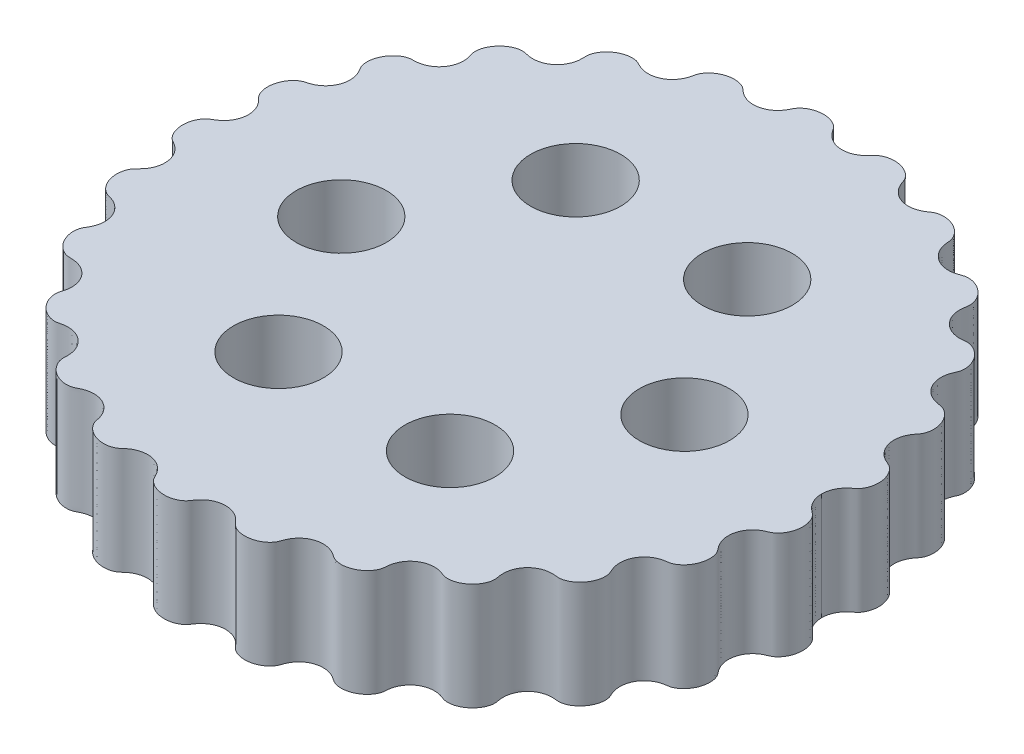
from build123d import *

# Parameters (mm, degrees)
ROTOR1_DEPTH       = 5
SKETCH5_R          = 2.1
CUT_EXTRUDE1_DEPTH = 23.326267833


with BuildPart() as part:
    # Sketch1 → Rotor1 (new body)
    with BuildSketch(Plane(origin=(0, 0, 0), x_dir=(1, 0, 0), z_dir=(0, 1, 0))):
        with BuildLine():
            add(Edge.make_bspline(
                [(14.4, -1.1e-08), (14.400000001, -0.017963894), (14.400999326, -0.054155771), (14.405496287, -0.123245553), (14.417452601, -0.205733741), (14.435300789, -0.284760877), (14.458936203, -0.363829831), (14.495530723, -0.460103307), (14.553831756, -0.577672691), (14.628963287, -0.690475205), (14.720523735, -0.795156223), (14.80987794, -0.878529689), (14.885972401, -0.9397103), (14.965266314, -0.996877195), (15.03939034, -1.060755698), (15.101813095, -1.136526895), (15.154322648, -1.21930658), (15.208602444, -1.329232804), (15.256294524, -1.468797203), (15.288097069, -1.638083711), (15.294503428, -1.881017906), (15.252298057, -2.119867925), (15.16376019, -2.344380173), (15.042398554, -2.52314005), (14.9424544, -2.628650553), (14.845312027, -2.70360375), (14.757199473, -2.750371146), (14.664408651, -2.786732336), (14.573413225, -2.826965825), (14.463621989, -2.885730191), (14.308968614, -2.990239538), (14.130503934, -3.165844743), (13.972147742, -3.43499293), (13.893985844, -3.773342005), (13.916927838, -4.080338895), (13.995171341, -4.310200428), (14.082412505, -4.468541995), (14.150259646, -4.567703683), (14.210026003, -4.642870289), (14.270573842, -4.717649144), (14.320176505, -4.800200547), (14.36541698, -4.91091898), (14.399338659, -5.049561586), (14.416852423, -5.262398452), (14.384340297, -5.500937495), (14.304056244, -5.731023401), (14.177986358, -5.941781702), (14.047854572, -6.095731645), (13.910789368, -6.208565645), (13.777136975, -6.284416215), (13.654566604, -6.325933746), (13.550560161, -6.341335346), (13.446683878, -6.355615291), (13.344146124, -6.378219331), (13.218559039, -6.416412649), (13.04911821, -6.490187823), (12.850381465, -6.623876986), (12.649361916, -6.848376683), (12.506075639, -7.152262016), (12.46299871, -7.451003009), (12.48997222, -7.692058425), (12.539204952, -7.862350555), (12.58028694, -7.968000468), (12.618270118, -8.050352823), (12.654435767, -8.133644583), (12.678284081, -8.221362494), (12.692938272, -8.335981047), (12.690655994, -8.476153316), (12.654303491, -8.685493404), (12.54522416, -8.951239009), (12.373057364, -9.183722763), (12.149188806, -9.366304637), (11.953264491, -9.463318235), (11.81158657, -9.506241349), (11.686731886, -9.522483882), (11.583489001, -9.516968781), (11.48115859, -9.503432854), (11.378198941, -9.496859112), (11.274929495, -9.498212512), (11.172138738, -9.508022541), (11.008490237, -9.538189742), (10.791018366, -9.615836409), (10.543765251, -9.778692295), (10.34743419, -10.024278367), (10.240209553, -10.268607441), (10.194326073, -10.4842437), (10.185348037, -10.638429751), (10.193137005, -10.770510335), (10.209146576, -10.879533557), (10.225593603, -10.966240354), (10.235972834, -11.05392192), (10.233096719, -11.142311638), (10.215769188, -11.253426288), (10.176716205, -11.384209809), (10.08855769, -11.57177312), (9.91455547, -11.800570796), (9.643929431, -12.015790483), (9.338394212, -12.131431673), (9.092328786, -12.151919742), (8.938831829, -12.124722538), (8.874148307, -12.104917743), (8.823297196, -12.086266856), (8.760022186, -12.062210577), (8.657742915, -12.026792744), (8.512708999, -11.991319827), (8.295428668, -11.971044841), (8.023342528, -12.005783702), (7.73974589, -12.120021515), (7.47748653, -12.330308834), (7.309271652, -12.575786303), (7.227746017, -12.796402048), (7.194848033, -12.964652458), (7.183073742, -13.072923144), (7.177410502, -13.159952349), (7.163856475, -13.268191895), (7.120744569, -13.39614672), (7.04321206, -13.535732436), (6.896275872, -13.715388924), (6.667818228, -13.896296593), (6.34777936, -14.038713503), (6.019985485, -14.072734215), (5.761855521, -14.02689024), (5.598538432, -13.943823805), (5.512636854, -13.880075553), (5.401773571, -13.805681519), (5.259872098, -13.730304703), (5.052431784, -13.656485844), (4.773827406, -13.622953758), (4.462559381, -13.668320856), (4.188839329, -13.79990472), (3.991155343, -13.966548509), (3.857834261, -14.133926135), (3.782595639, -14.263163531), (3.730895647, -14.379947227), (3.695923763, -14.480038245), (3.668903683, -14.56056134), (3.625076849, -14.657311176), (3.549396382, -14.764707524), (3.439982987, -14.875186994), (3.255658046, -15.006023463), (2.992827117, -15.120144486), (2.651469382, -15.175704072), (2.340640957, -15.129056719), (2.125825137, -15.033765697), (2.0109526, -14.946775258), (1.969759875, -14.909017921), (1.931739531, -14.868053182), (1.895416415, -14.825543648), (1.849863563, -14.772584704), (1.773476319, -14.691024514), (1.657607739, -14.58933026), (1.467716703, -14.468702831), (1.201270749, -14.374830119), (0.894276571, -14.351781834), (0.570473164, -14.423577287), (0.317305916, -14.563244762), (0.151544643, -14.71409474), (0.048135647, -14.841769028), (-0.01140708, -14.928873481), (-0.056990691, -15.000050013), (-0.120513062, -15.084517626), (-0.216680184, -15.171117906), (-0.345491317, -15.25208282), (-0.548377466, -15.33558494), (-0.812768021, -15.385413136), (-1.083980216, -15.372591716), (-1.344979283, -15.297228961), (-1.543453142, -15.19218871), (-1.665764404, -15.097632002), (-1.75467, -15.002005337), (-1.81122418, -14.912766185), (-1.848284561, -14.836853547), (-1.894839734, -14.742231052), (-1.981132515, -14.596441396), (-2.130461088, -14.415292521), (-2.371747192, -14.237403678), (-2.694146204, -14.124304526), (-3.00580735, -14.112083078), (-3.279802357, -14.174238379), (-3.481365582, -14.271329132), (-3.607737754, -14.358113062), (-3.692850266, -14.429558393), (-3.744273423, -14.476277873), (-3.785484048, -14.513603542), (-3.839036737, -14.557816843), (-3.971847519, -14.642561779), (-4.209211631, -14.716336919), (-4.537869667, -14.723206573), (-4.870972703, -14.623310425), (-5.119164172, -14.474114236), (-5.287202357, -14.316128426), (-5.381818833, -14.188749939), (-5.441586271, -14.068625415), (-5.469754046, -13.96393733), (-5.486204802, -13.878819152), (-5.510615225, -13.773376721), (-5.562785516, -13.61120241), (-5.668639734, -13.402851242), (-5.861501349, -13.18079115), (-6.14085754, -13.003605886), (-6.432388672, -12.920479695), (-6.707046713, -12.913936066), (-6.924587046, -12.957969147), (-7.070502284, -13.011927123), (-7.171892355, -13.061227482), (-7.234172187, -13.094294519), (-7.284237966, -13.120336872), (-7.348454177, -13.149383224), (-7.450392576, -13.181306018), (-7.592859792, -13.199325292), (-7.822504064, -13.187514172), (-8.108178875, -13.101882472), (-8.360699691, -12.948082179), (-8.56405426, -12.739258029), (-8.686860053, -12.541026044), (-8.745858749, -12.391334179), (-8.771139119, -12.257945579), (-8.769723315, -12.14815898), (-8.764488551, -12.060600173), (-8.763283582, -11.951025385), (-8.773134224, -11.821212482), (-8.801859183, -11.67318997), (-8.87293741, -11.471740747), (-9.004528298, -11.249999101), (-9.220497993, -11.035107096), (-9.499737781, -10.890462341), (-9.747533495, -10.836885361), (-9.938295959, -10.832213565), (-10.067515078, -10.843724623), (-10.169837321, -10.860857981), (-10.270401197, -10.885915994), (-10.371724744, -10.908895815), (-10.499540671, -10.914403519), (-10.649899256, -10.893032474), (-10.864421886, -10.823595876), (-11.11544678, -10.670179915), (-11.318488147, -10.460805612), (-11.461426498, -10.211875776), (-11.524752754, -10.013392042), (-11.54639171, -9.877678085), (-11.548709874, -9.764594249), (-11.539339892, -9.676135228), (-11.51689836, -9.590207333), (-11.489593106, -9.505764861), (-11.460576413, -9.398791422), (-11.437115918, -9.267755393), (-11.42803848, -9.112624471), (-11.448899308, -8.891732784), (-11.52530639, -8.644379333), (-11.68055983, -8.391694705), (-11.908334995, -8.189292895), (-12.146089544, -8.066432183), (-12.351540755, -8.011178804), (-12.50904114, -7.991840063), (-12.640826545, -7.989461105), (-12.746563864, -7.988166796), (-12.874375605, -7.963828486), (-13.017764361, -7.905880361), (-13.169248996, -7.811412388), (-13.319017854, -7.674675035), (-13.47198151, -7.4805153), (-13.581458667, -7.260884047), (-13.644013277, -7.026575735), (-13.652860933, -6.812940366), (-13.636539219, -6.672850754), (-13.606445562, -6.560514665), (-13.5704312, -6.476446597), (-13.523165998, -6.398238128), (-13.475169451, -6.320638422), (-13.421523077, -6.21994929), (-13.352206488, -6.055610082), (-13.297223183, -5.817806124), (-13.306143986, -5.511232263), (-13.418270839, -5.185792922), (-13.599550715, -4.937286073), (-13.788421698, -4.782571096), (-13.950444342, -4.693123085), (-14.068010596, -4.644081988), (-14.164678234, -4.612081983), (-14.263358753, -4.586968886), (-14.360622629, -4.556204214), (-14.472064523, -4.49721383), (-14.590574809, -4.405388295), (-14.741515636, -4.240877255), (-14.885567724, -3.984040428), (-14.960547267, -3.700013982), (-14.962476973, -3.409357409), (-14.917122568, -3.199365531), (-14.864866156, -3.065550936), (-14.804762438, -2.961268377), (-14.743749554, -2.885986234), (-14.673498565, -2.819366634), (-14.60475992, -2.751454607), (-14.541077446, -2.678635692), (-14.482882317, -2.601336949), (-14.398435031, -2.468449098), (-14.309915891, -2.267782125), (-14.257239547, -1.991630617), (-14.29476544, -1.652711575), (-14.415656618, -1.372497585), (-14.564768476, -1.180602926), (-14.700945674, -1.058517784), (-14.80150165, -0.985661518), (-14.885953431, -0.93356628), (-14.973240483, -0.886147273), (-15.05595315, -0.830915849), (-15.145345979, -0.745703031), (-15.234104558, -0.627877118), (-15.302099628, -0.497917395), (-15.350570862, -0.359469928), (-15.378415703, -0.242180994), (-15.393222628, -0.14728859), (-15.398767773, -0.063519343), (-15.399999999, -0.021213781), (-15.4, -1.47e-06)],
                knots=[0.062565796, 0.062565796, 0.062565796, 0.062565796, 0.062565796, 0.063859973, 0.06515415, 0.066448326, 0.067742503, 0.06903668, 0.070330857, 0.07291921, 0.075992333, 0.077528894, 0.079065456, 0.080602017, 0.082138578, 0.08367514, 0.085211701, 0.086753761, 0.088295822, 0.091379943, 0.094464064, 0.097548185, 0.103528845, 0.106519174, 0.109509504, 0.111075374, 0.112641243, 0.114207112, 0.115772981, 0.117338851, 0.11890472, 0.122036458, 0.127492162, 0.132947866, 0.138255082, 0.143562297, 0.146585003, 0.148096356, 0.149607709, 0.151119061, 0.152630414, 0.154141767, 0.15565312, 0.158617995, 0.161582869, 0.167512619, 0.170668106, 0.173823593, 0.17697908, 0.180134567, 0.181785014, 0.183435461, 0.185085908, 0.186736355, 0.188386802, 0.190037249, 0.193338142, 0.198333612, 0.203329082, 0.208757311, 0.21418554, 0.217038738, 0.218465337, 0.219891935, 0.221318534, 0.222745133, 0.224171732, 0.225598331, 0.22856804, 0.23153775, 0.237477169, 0.243508984, 0.246524892, 0.2495408, 0.251163787, 0.252786774, 0.254409762, 0.256032749, 0.257655736, 0.259278723, 0.26090171, 0.262524697, 0.268116353, 0.273708009, 0.279232337, 0.2819945, 0.284756664, 0.287531357, 0.288918704, 0.290306051, 0.291693397, 0.293080744, 0.294468091, 0.295855437, 0.298751953, 0.301648468, 0.307441499, 0.313806246, 0.320170993, 0.321874543, 0.322726318, 0.323578093, 0.324429868, 0.325281643, 0.326985192, 0.330392292, 0.333799391, 0.338941908, 0.344084424, 0.349371027, 0.354657629, 0.357399899, 0.358771034, 0.360142168, 0.361513303, 0.362884438, 0.365626708, 0.368571539, 0.37151637, 0.377406032, 0.383827609, 0.390249186, 0.391929851, 0.393610516, 0.39529118, 0.396971845, 0.400333174, 0.403694503, 0.409075747, 0.41445699, 0.419832854, 0.422520785, 0.425208717, 0.427878342, 0.429213155, 0.430547968, 0.431882781, 0.433217593, 0.435887219, 0.438758038, 0.441628857, 0.447370496, 0.453780785, 0.460191075, 0.461070296, 0.461949517, 0.462828738, 0.463707959, 0.46458718, 0.465466401, 0.467224842, 0.470741726, 0.47425861, 0.479541903, 0.484825197, 0.489835983, 0.494846769, 0.497503724, 0.498832202, 0.500160679, 0.501489157, 0.502817634, 0.505474589, 0.508247059, 0.511019529, 0.516564468, 0.52227034, 0.525123276, 0.527976212, 0.530631288, 0.531958826, 0.533286364, 0.534613902, 0.53594144, 0.538596516, 0.543936045, 0.549275574, 0.554531257, 0.559786941, 0.563284399, 0.566781857, 0.568530587, 0.569404951, 0.570279316, 0.57115368, 0.572028045, 0.573776774, 0.580152949, 0.586529123, 0.592383377, 0.595310504, 0.598237631, 0.600962992, 0.602325673, 0.603688354, 0.605051034, 0.606413715, 0.609139076, 0.614392618, 0.619646159, 0.624660447, 0.629674735, 0.633223523, 0.636772312, 0.638546707, 0.639433904, 0.640321101, 0.641208298, 0.642095495, 0.64386989, 0.647025799, 0.650181709, 0.656493529, 0.662419511, 0.665382503, 0.668345494, 0.671104535, 0.672484055, 0.673863575, 0.675243096, 0.676622616, 0.679381657, 0.682041398, 0.68470114, 0.690020622, 0.695473381, 0.700926139, 0.704188253, 0.70581931, 0.707450368, 0.709081425, 0.710712482, 0.712343539, 0.713974596, 0.717095441, 0.720216286, 0.726457975, 0.732286917, 0.735201388, 0.738115858, 0.739511278, 0.740906697, 0.742302116, 0.743697535, 0.745092954, 0.746488373, 0.749279211, 0.752059022, 0.754838832, 0.760398454, 0.765423781, 0.770449108, 0.773768675, 0.777088241, 0.778748025, 0.780407808, 0.782067591, 0.783727374, 0.786901153, 0.790074931, 0.793248709, 0.796422487, 0.802397424, 0.805384893, 0.808372361, 0.809807963, 0.811243566, 0.812679168, 0.81411477, 0.815550372, 0.816985974, 0.819857178, 0.825317904, 0.830778629, 0.835989797, 0.841200965, 0.844404173, 0.846005778, 0.847607382, 0.849208986, 0.85081059, 0.852412194, 0.854013798, 0.857107086, 0.860200373, 0.866386948, 0.872352981, 0.875335998, 0.878319014, 0.879839881, 0.881360748, 0.882881615, 0.884402482, 0.885923349, 0.887444216, 0.888965083, 0.890485949, 0.895823145, 0.90116034, 0.906397405, 0.911634469, 0.914757263, 0.91631866, 0.917880057, 0.919441454, 0.921002851, 0.922564248, 0.924125645, 0.927182053, 0.930238461, 0.931766665, 0.933294869, 0.934823073, 0.936351306, 0.936351306, 0.936351306, 0.936351306, 0.936351306], degree=4))
            add(Edge.make_bspline(
                [(14.4, -1.1e-08), (14.4, 0.017963997), (14.400999323, 0.054155874), (14.405496281, 0.123245656), (14.417452591, 0.205733845), (14.435300775, 0.284760982), (14.458936185, 0.363829937), (14.4955307, 0.460103415), (14.553831728, 0.577672801), (14.628963253, 0.69047532), (14.720523696, 0.795156341), (14.809877897, 0.878529812), (14.885972355, 0.939710427), (14.965266265, 0.996877326), (15.039390288, 1.060755833), (15.10181304, 1.136527033), (15.154322588, 1.21930672), (15.208602379, 1.329232947), (15.256294452, 1.468797348), (15.288096989, 1.638083858), (15.294503336, 1.881018053), (15.252297954, 2.11986807), (15.163760076, 2.344380314), (15.042398431, 2.523140184), (14.942454271, 2.628650683), (14.845311894, 2.703603875), (14.757199339, 2.750371267), (14.664408514, 2.786732452), (14.573413087, 2.826965937), (14.463621848, 2.885730297), (14.308968467, 2.990239637), (14.130503779, 3.165844833), (13.972147573, 3.434993012), (13.893985659, 3.773342084), (13.916927638, 4.080338975), (13.99517113, 4.310200511), (14.082412286, 4.468542083), (14.150259423, 4.567703774), (14.210025776, 4.642870383), (14.270573611, 4.717649241), (14.32017627, 4.800200647), (14.365416739, 4.910919082), (14.399338411, 5.049561689), (14.416852165, 5.262398556), (14.384340028, 5.500937598), (14.304055963, 5.7310235), (14.177986067, 5.941781795), (14.047854273, 6.095731731), (13.910789064, 6.208565725), (13.777136668, 6.284416288), (13.654566295, 6.325933813), (13.550559851, 6.341335407), (13.446683566, 6.355615347), (13.344145812, 6.378219382), (13.218558725, 6.416412695), (13.049117892, 6.49018786), (12.850381141, 6.623877014), (12.649361581, 6.8483767), (12.506075288, 7.152262026), (12.462998345, 7.451003017), (12.489971843, 7.692058434), (12.539204567, 7.862350567), (12.58028655, 7.968000482), (12.618269724, 8.050352839), (12.654435369, 8.1336446), (12.678283679, 8.221362513), (12.692937864, 8.335981067), (12.690655579, 8.476153336), (12.654303066, 8.685493422), (12.545223721, 8.951239022), (12.373056915, 9.183722767), (12.149188347, 9.36630463), (11.953264028, 9.463318219), (11.811586105, 9.506241326), (11.68673142, 9.522483852), (11.583488535, 9.516968746), (11.481158125, 9.503432814), (11.378198476, 9.496859067), (11.27492903, 9.498212462), (11.172138272, 9.508022486), (11.00848977, 9.538189679), (10.791017895, 9.615836336), (10.543764772, 9.778692209), (10.347433699, 10.024278272), (10.24020905, 10.26860734), (10.194325559, 10.484243597), (10.185347516, 10.638429648), (10.193136478, 10.770510232), (10.209146043, 10.879533455), (10.225593066, 10.966240253), (10.235972292, 11.053921819), (10.233096174, 11.142311537), (10.215768637, 11.253426187), (10.176715648, 11.384209706), (10.088557124, 11.571773012), (9.914554892, 11.80057068), (9.643928842, 12.015790353), (9.338393618, 12.131431528), (9.092328191, 12.151919585), (8.938831235, 12.124722374), (8.874147714, 12.104917576), (8.823296604, 12.086266686), (8.760021595, 12.062210404), (8.657742326, 12.026792566), (8.512708411, 11.991319642), (8.295428082, 11.971044645), (8.02334194, 12.005783493), (7.739745297, 12.120021292), (7.477485926, 12.330308598), (7.309271036, 12.575786059), (7.227745391, 12.7964018), (7.194847398, 12.964652209), (7.183073102, 13.072922894), (7.177409857, 13.159952099), (7.163855825, 13.268191644), (7.120743913, 13.396146467), (7.043211398, 13.535732179), (6.8962752, 13.71538866), (6.667817547, 13.896296318), (6.347778672, 14.038713212), (6.019984796, 14.072733908), (5.761854834, 14.02688992), (5.59853775, 13.943823477), (5.512636175, 13.880075221), (5.401772895, 13.805681182), (5.259871426, 13.730304358), (5.052431116, 13.65648549), (4.773826739, 13.62295339), (4.462558712, 13.668320473), (4.188838653, 13.799904324), (3.991154659, 13.966548102), (3.857833569, 14.133925722), (3.78259494, 14.263163115), (3.730894943, 14.379946808), (3.695923054, 14.480037824), (3.66890297, 14.560560918), (3.625076131, 14.657310752), (3.549395659, 14.764707096), (3.439982259, 14.87518656), (3.255657311, 15.006023021), (2.992826376, 15.12014403), (2.651468639, 15.1757036), (2.340640217, 15.129056231), (2.125824401, 15.033765199), (2.010951868, 14.946774755), (1.969759145, 14.909017416), (1.931738803, 14.868052675), (1.895415689, 14.825543138), (1.84986284, 14.772584192), (1.773475599, 14.691023999), (1.657607025, 14.589329739), (1.467715995, 14.468702301), (1.201270045, 14.374829576), (0.894275868, 14.351781276), (0.570472458, 14.423576713), (0.317305203, 14.563244175), (0.151543923, 14.714094145), (0.04813492, 14.841768429), (-0.011407811, 14.928872879), (-0.056991425, 15.000049408), (-0.120513801, 15.084517019), (-0.216680927, 15.171117293), (-0.345492063, 15.252082201), (-0.548378217, 15.335584311), (-0.812768774, 15.385412494), (-1.083980969, 15.372591061), (-1.344980032, 15.297228294), (-1.543453885, 15.192188032), (-1.665765143, 15.097631318), (-1.754670735, 15.00200465), (-1.81122491, 14.912765494), (-1.848285287, 14.836852855), (-1.894840456, 14.742230357), (-1.98113323, 14.596440697), (-2.130461793, 14.415291815), (-2.371747889, 14.23740296), (-2.694146896, 14.124303792), (-3.005808041, 14.112082329), (-3.279803051, 14.174237617), (-3.481366281, 14.271328359), (-3.607738457, 14.358112283), (-3.692850973, 14.42955761), (-3.744274132, 14.476277088), (-3.785484759, 14.513602755), (-3.83903745, 14.557816053), (-3.971848236, 14.642560982), (-4.209212351, 14.716336112), (-4.537870388, 14.723205749), (-4.870973419, 14.623309584), (-5.11916488, 14.474113384), (-5.287203058, 14.316127565), (-5.381819528, 14.188749074), (-5.44158696, 14.068624547), (-5.46975473, 13.96393646), (-5.486205481, 13.878818281), (-5.510615899, 13.77337585), (-5.562786182, 13.611201536), (-5.66864039, 13.402850363), (-5.861501995, 13.180790261), (-6.140858177, 13.003604984), (-6.432389304, 12.920478779), (-6.707047346, 12.913935136), (-6.924587681, 12.957968207), (-7.070502921, 13.011926175), (-7.171892995, 13.061226529), (-7.234172828, 13.094293563), (-7.284238608, 13.120335914), (-7.348454821, 13.149382263), (-7.450393222, 13.181305052), (-7.592860438, 13.199324318), (-7.822504709, 13.187513187), (-8.108179517, 13.101881473), (-8.360700325, 12.948081167), (-8.564054883, 12.739257008), (-8.686860667, 12.541025017), (-8.745859355, 12.391333149), (-8.771139719, 12.257944548), (-8.76972391, 12.148157949), (-8.764489142, 12.060599142), (-8.763284167, 11.951024354), (-8.773134803, 11.821211451), (-8.801859755, 11.673188937), (-8.872937972, 11.471739711), (-9.004528849, 11.249998058), (-9.220498534, 11.035106043), (-9.499738314, 10.890461274), (-9.747534026, 10.836884282), (-9.93829649, 10.832212477), (-10.067515609, 10.843723528), (-10.169837853, 10.860856882), (-10.27040173, 10.885914889), (-10.371725278, 10.908894705), (-10.499541206, 10.914402403), (-10.649899789, 10.893031351), (-10.864422416, 10.823594743), (-11.115447303, 10.670178769), (-11.31848866, 10.460804456), (-11.461426998, 10.211874613), (-11.524753245, 10.013390876), (-11.546392194, 9.877676918), (-11.548710352, 9.764593082), (-11.539340366, 9.676134061), (-11.516898829, 9.590206168), (-11.489593571, 9.505763697), (-11.460576873, 9.398790259), (-11.437116372, 9.267754231), (-11.428038926, 9.112623309), (-11.448899743, 8.891731622), (-11.525306813, 8.644378167), (-11.680560241, 8.391693532), (-11.908335396, 8.189291711), (-12.146089939, 8.066430986), (-12.351541147, 8.011177597), (-12.509041531, 7.991838848), (-12.640826936, 7.989459884), (-12.746564255, 7.98816557), (-12.874375995, 7.963827254), (-13.017764748, 7.905879122), (-13.169249379, 7.811411141), (-13.319018229, 7.674673781), (-13.471981877, 7.480514038), (-13.581459023, 7.26088278), (-13.644013621, 7.026574465), (-13.652861266, 6.812939095), (-13.636539546, 6.672849485), (-13.606445884, 6.560513397), (-13.570431517, 6.476445331), (-13.523166311, 6.398236864), (-13.47516976, 6.32063716), (-13.421523381, 6.219948031), (-13.352206784, 6.055608826), (-13.297223468, 5.817804871), (-13.306144256, 5.51123101), (-13.418271093, 5.185791663), (-13.599550957, 4.937284805), (-13.788421932, 4.782569819), (-13.950444572, 4.6931218), (-14.068010823, 4.644080697), (-14.16467846, 4.612080687), (-14.263358978, 4.586967586), (-14.360622852, 4.556202909), (-14.472064743, 4.497212519), (-14.590575025, 4.405386979), (-14.741515844, 4.240875931), (-14.885567919, 3.984039098), (-14.960547448, 3.700012648), (-14.96247714, 3.409356074), (-14.917122724, 3.199364199), (-14.864866306, 3.065549606), (-14.804762583, 2.96126705), (-14.743749696, 2.88598491), (-14.673498703, 2.819365313), (-14.604760055, 2.75145329), (-14.541077577, 2.678634378), (-14.482882445, 2.601335638), (-14.398435152, 2.468447791), (-14.309916002, 2.267780823), (-14.257239645, 1.991629317), (-14.294765521, 1.652710273), (-14.415656685, 1.372496277), (-14.564768534, 1.180601611), (-14.700945726, 1.058516462), (-14.801501699, 0.985660191), (-14.885953477, 0.933564949), (-14.973240527, 0.886145938), (-15.055953191, 0.83091451), (-15.145346016, 0.745701687), (-15.234104589, 0.62787577), (-15.302099652, 0.497916044), (-15.350570879, 0.359468574), (-15.378415715, 0.242179639), (-15.393222635, 0.147287235), (-15.398767777, 0.063517987), (-15.4, 0.021212425), (-15.4, -1.47e-06)],
                knots=[0.062565796, 0.062565796, 0.062565796, 0.062565796, 0.062565796, 0.063859973, 0.06515415, 0.066448326, 0.067742503, 0.06903668, 0.070330857, 0.07291921, 0.075992333, 0.077528894, 0.079065456, 0.080602017, 0.082138578, 0.08367514, 0.085211701, 0.086753761, 0.088295822, 0.091379943, 0.094464064, 0.097548185, 0.103528845, 0.106519174, 0.109509504, 0.111075374, 0.112641243, 0.114207112, 0.115772981, 0.117338851, 0.11890472, 0.122036458, 0.127492162, 0.132947866, 0.138255082, 0.143562297, 0.146585003, 0.148096356, 0.149607709, 0.151119061, 0.152630414, 0.154141767, 0.15565312, 0.158617995, 0.161582869, 0.167512619, 0.170668106, 0.173823593, 0.17697908, 0.180134567, 0.181785014, 0.183435461, 0.185085908, 0.186736355, 0.188386802, 0.190037249, 0.193338142, 0.198333612, 0.203329082, 0.208757311, 0.21418554, 0.217038738, 0.218465337, 0.219891935, 0.221318534, 0.222745133, 0.224171732, 0.225598331, 0.22856804, 0.23153775, 0.237477169, 0.243508984, 0.246524892, 0.2495408, 0.251163787, 0.252786774, 0.254409762, 0.256032749, 0.257655736, 0.259278723, 0.26090171, 0.262524697, 0.268116353, 0.273708009, 0.279232337, 0.2819945, 0.284756664, 0.287531357, 0.288918704, 0.290306051, 0.291693397, 0.293080744, 0.294468091, 0.295855437, 0.298751953, 0.301648468, 0.307441499, 0.313806246, 0.320170993, 0.321874543, 0.322726318, 0.323578093, 0.324429868, 0.325281643, 0.326985192, 0.330392292, 0.333799391, 0.338941908, 0.344084424, 0.349371027, 0.354657629, 0.357399899, 0.358771034, 0.360142168, 0.361513303, 0.362884438, 0.365626708, 0.368571539, 0.37151637, 0.377406032, 0.383827609, 0.390249186, 0.391929851, 0.393610516, 0.39529118, 0.396971845, 0.400333174, 0.403694503, 0.409075747, 0.41445699, 0.419832854, 0.422520785, 0.425208717, 0.427878342, 0.429213155, 0.430547968, 0.431882781, 0.433217593, 0.435887219, 0.438758038, 0.441628857, 0.447370496, 0.453780785, 0.460191075, 0.461070296, 0.461949517, 0.462828738, 0.463707959, 0.46458718, 0.465466401, 0.467224842, 0.470741726, 0.47425861, 0.479541903, 0.484825197, 0.489835983, 0.494846769, 0.497503724, 0.498832202, 0.500160679, 0.501489157, 0.502817634, 0.505474589, 0.508247059, 0.511019529, 0.516564468, 0.52227034, 0.525123276, 0.527976212, 0.530631288, 0.531958826, 0.533286364, 0.534613902, 0.53594144, 0.538596516, 0.543936045, 0.549275574, 0.554531257, 0.559786941, 0.563284399, 0.566781857, 0.568530587, 0.569404951, 0.570279316, 0.57115368, 0.572028045, 0.573776774, 0.580152949, 0.586529123, 0.592383377, 0.595310504, 0.598237631, 0.600962992, 0.602325673, 0.603688354, 0.605051034, 0.606413715, 0.609139076, 0.614392618, 0.619646159, 0.624660447, 0.629674735, 0.633223523, 0.636772312, 0.638546707, 0.639433904, 0.640321101, 0.641208298, 0.642095495, 0.64386989, 0.647025799, 0.650181709, 0.656493529, 0.662419511, 0.665382503, 0.668345494, 0.671104535, 0.672484055, 0.673863575, 0.675243096, 0.676622616, 0.679381657, 0.682041398, 0.68470114, 0.690020622, 0.695473381, 0.700926139, 0.704188253, 0.70581931, 0.707450368, 0.709081425, 0.710712482, 0.712343539, 0.713974596, 0.717095441, 0.720216286, 0.726457975, 0.732286917, 0.735201388, 0.738115858, 0.739511278, 0.740906697, 0.742302116, 0.743697535, 0.745092954, 0.746488373, 0.749279211, 0.752059022, 0.754838832, 0.760398454, 0.765423781, 0.770449108, 0.773768675, 0.777088241, 0.778748025, 0.780407808, 0.782067591, 0.783727374, 0.786901153, 0.790074931, 0.793248709, 0.796422487, 0.802397424, 0.805384893, 0.808372361, 0.809807963, 0.811243566, 0.812679168, 0.81411477, 0.815550372, 0.816985974, 0.819857178, 0.825317904, 0.830778629, 0.835989797, 0.841200965, 0.844404173, 0.846005778, 0.847607382, 0.849208986, 0.85081059, 0.852412194, 0.854013798, 0.857107086, 0.860200373, 0.866386948, 0.872352981, 0.875335998, 0.878319014, 0.879839881, 0.881360748, 0.882881615, 0.884402482, 0.885923349, 0.887444216, 0.888965083, 0.890485949, 0.895823145, 0.90116034, 0.906397405, 0.911634469, 0.914757263, 0.91631866, 0.917880057, 0.919441454, 0.921002851, 0.922564248, 0.924125645, 0.927182053, 0.930238461, 0.931766665, 0.933294869, 0.934823073, 0.936351277, 0.936351277, 0.936351277, 0.936351277, 0.936351277], degree=4))
        make_face()
    extrude(amount=ROTOR1_DEPTH)

    # Sketch5 → Cut-Extrude1 (cut, through all)
    with BuildSketch(Plane(origin=(0, 0, 0), x_dir=(1, 0, 0), z_dir=(0, 1, 0))):
        with Locations((8, 0)):
            Circle(SKETCH5_R)
        with Locations((4, 6.92820323)):
            Circle(SKETCH5_R)
        with Locations((-4, 6.92820323)):
            Circle(SKETCH5_R)
        with Locations((-8, 0)):
            Circle(SKETCH5_R)
        with Locations((-4, -6.92820323)):
            Circle(SKETCH5_R)
        with Locations((4, -6.92820323)):
            Circle(SKETCH5_R)
    extrude(amount=CUT_EXTRUDE1_DEPTH, mode=Mode.SUBTRACT)


solid = part.part
